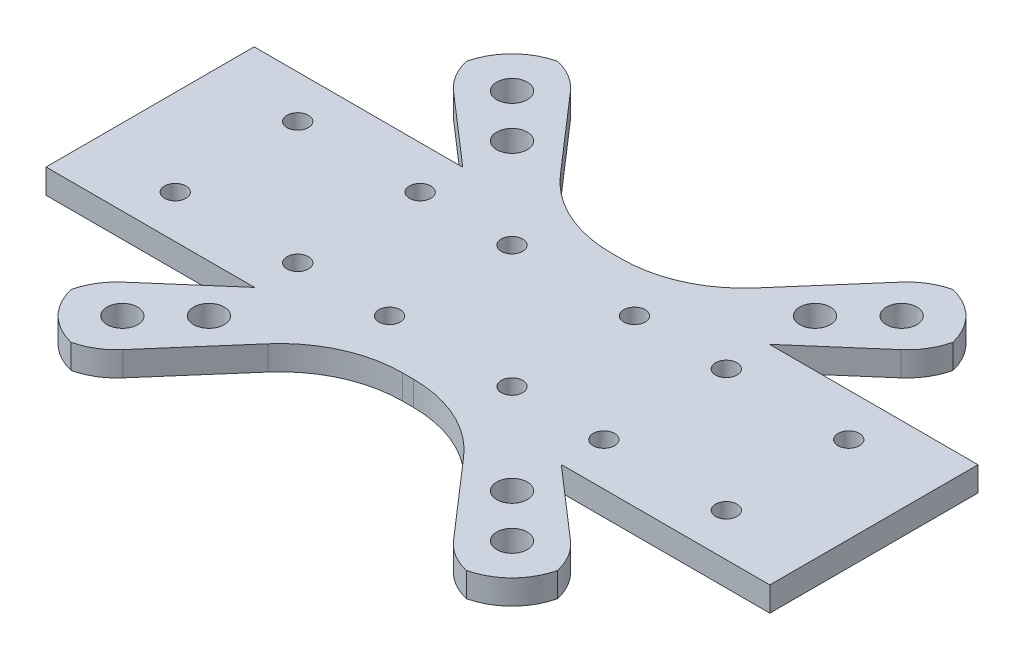
from build123d import *

# Parameters (mm, degrees)
SKETCH1_W           = 80
SKETCH1_H           = 80
SKETCH1_R           = 2.5
SKETCH1_R_2         = 1.75
BOSS_EXTRUDE1_DEPTH = 4
CUT_EXTRUDE2_DEPTH  = 57.709787515
FILLET1_R           = 10
FILLET2_R           = 20
BOSS_EXTRUDE3_DEPTH = 4
SKETCH6_R           = 1.75
CUT_EXTRUDE3_DEPTH  = 4


with BuildPart() as part:
    # Sketch1 → Boss-Extrude1 (new body)
    with BuildSketch(Plane(origin=(0, 0, 0), x_dir=(1, 0, 0), z_dir=(0, 1, 0))):
        Rectangle(SKETCH1_W, SKETCH1_H)
        with Locations(Location((-24.748737342, 24.748737342, 0), (0, 0, 270))):
            Circle(SKETCH1_R, mode=Mode.SUBTRACT)
        with Locations(Location((24.748737342, 24.748737342, 0), (0, 0, 270))):
            Circle(SKETCH1_R, mode=Mode.SUBTRACT)
        with Locations(Location((24.748737342, -24.748737342, 0), (0, 0, 270))):
            Circle(SKETCH1_R, mode=Mode.SUBTRACT)
        with Locations(Location((-24.748737342, -24.748737342, 0), (0, 0, 270))):
            Circle(SKETCH1_R, mode=Mode.SUBTRACT)
        with Locations(Location((-10, 10, 0), (0, 0, 270))):
            Circle(SKETCH1_R_2, mode=Mode.SUBTRACT)
        with Locations(Location((10, 10, 0), (0, 0, 270))):
            Circle(SKETCH1_R_2, mode=Mode.SUBTRACT)
        with Locations(Location((10, -10, 0), (0, 0, 270))):
            Circle(SKETCH1_R_2, mode=Mode.SUBTRACT)
        with Locations(Location((-10, -10, 0), (0, 0, 270))):
            Circle(SKETCH1_R_2, mode=Mode.SUBTRACT)
        with Locations(Location((31.819805153, 31.819805153, 0), (0, 0, 270))):
            Circle(SKETCH1_R, mode=Mode.SUBTRACT)
        with Locations(Location((-31.819805153, 31.819805153, 0), (0, 0, 270))):
            Circle(SKETCH1_R, mode=Mode.SUBTRACT)
        with Locations(Location((-31.819805153, -31.819805153, 0), (0, 0, 270))):
            Circle(SKETCH1_R, mode=Mode.SUBTRACT)
        with Locations(Location((31.819805153, -31.819805153, 0), (0, 0, 270))):
            Circle(SKETCH1_R, mode=Mode.SUBTRACT)
    extrude(amount=BOSS_EXTRUDE1_DEPTH)

    # Sketch2 → Cut-Extrude2 (cut, through all)
    with BuildSketch(Plane(origin=(0, 4, 0), x_dir=(1, 0, 0), z_dir=(0, 1, 0))):
        Polygon((-40, 30), (-40, -30), (-17, -10), (-17, 10), align=None)
        Polygon((30, 40), (-30, 40), (-10, 17), (10, 17), align=None)
        Polygon((40, -30), (40, 30), (17, 10), (17, -10), align=None)
        Polygon((-30, -40), (30, -40), (10, -17), (-10, -17), align=None)
    extrude(amount=-CUT_EXTRUDE2_DEPTH, mode=Mode.SUBTRACT)

    # Fillet1
    # the kernel refuses this fillet: 10 mm, written as the material it takes off along each edge
    with BuildSketch(Plane(origin=(-30, 15.390762292, 40), x_dir=(-1, 0, 0), z_dir=(0, -1, 0)), Plane(origin=(-40, 15.390762292, 30), x_dir=(0.754605522163505, 0, -0.6561787149247863), z_dir=(0, -1, 0)), Plane(origin=(-40, 15.390762292, -30), x_dir=(0, 0, -1), z_dir=(0, -1, 0)), Plane(origin=(-30, 15.390762292, -40), x_dir=(0.6561787149247871, 0, 0.7546055221635043), z_dir=(0, -1, 0)), Plane(origin=(30, 15.390762292, -40), x_dir=(1, 0, 0), z_dir=(0, -1, 0)), Plane(origin=(40, 15.390762292, -30), x_dir=(-0.7546055221635045, 0, 0.6561787149247867), z_dir=(0, -1, 0)), Plane(origin=(40, 15.390762292, 30), x_dir=(0, 0, 1), z_dir=(0, -1, 0))) as fillet1_piece_1:
        with BuildLine():
            CenterArc((FILLET1_R * 0.455630491663, FILLET1_R), FILLET1_R, 221.009086902, 48.990913098)
            Line((-FILLET1_R * 0.2989750305, FILLET1_R * 0.343821285075), (0, 0))
            Line((0, 0), (FILLET1_R * 0.455630491663, 0))
        make_face()
    extrude(amount=26.781524583, mode=Mode.SUBTRACT)
    with BuildSketch(Plane(origin=(-40, -25, 40), x_dir=(0, 0, -1), z_dir=(0, 1, 0)), Plane(origin=(-40, -25, -40), x_dir=(1, 0, 0), z_dir=(0, 1, 0)), Plane(origin=(40, -25, -40), x_dir=(0, 0, 1), z_dir=(0, 1, 0)), Plane(origin=(40, -25, 40), x_dir=(-1, 0, 0), z_dir=(0, 1, 0))) as fillet1_piece_2:
        with BuildLine():
            CenterArc((FILLET1_R, -FILLET1_R), FILLET1_R, 90, 90)
            Line((0, -FILLET1_R), (0, 0))
            Line((0, 0), (FILLET1_R, 0))
        make_face()
    extrude(amount=54, mode=Mode.SUBTRACT)
    with BuildSketch(Plane(origin=(30, 15.390762292, 40), x_dir=(1, 0, 0), z_dir=(0, -1, 0))) as fillet1_piece_3:
        with BuildLine():
            CenterArc((FILLET1_R * 0.455630491663, -FILLET1_R), FILLET1_R, 90, 48.990913098)
            Line((-FILLET1_R * 0.2989750305, -FILLET1_R * 0.343821285075), (0, 0))
            Line((0, 0), (FILLET1_R * 0.455630491663, 0))
        make_face()
    extrude(amount=26.781524583, mode=Mode.SUBTRACT)

    # Fillet2
    fillet2_edges = [part.edges().sort_by_distance(p)[0] for p in [
        (10, 2, 17),
        (-10, 2, 17),
        (-17, 2, 10),
        (-17, 2, -10),
        (17, 2, -10),
        (17, 2, 10),
        (-10, 2, -17),
        (10, 2, -17),
    ]]
    fillet(fillet2_edges, radius=FILLET2_R)

    # Sketch5 → Boss-Extrude3 (add)
    with BuildSketch(Plane(origin=(0, 4, 0), x_dir=(1, 0, 0), z_dir=(0, 1, 0))):
        Polygon((-0.887390167, 17), (13.289046487, 12.123524967), (13.289046487, -13.496190448), (-0.887390167, -17), (59.112609833, -17), (59.112609833, 17), align=None)
    boss_extrude3 = extrude(amount=-BOSS_EXTRUDE3_DEPTH)

    # Sketch6 → Cut-Extrude3 (cut)
    with BuildSketch(Plane(origin=(0, 4, 0), x_dir=(1, 0, 0), z_dir=(0, 1, 0))):
        with Locations(Location((25, 10, 0), (0, 0, 270))):
            Circle(SKETCH6_R)
        with Locations(Location((45, 10, 0), (0, 0, 270))):
            Circle(SKETCH6_R)
        with Locations(Location((25, -10, 0), (0, 0, 270))):
            Circle(SKETCH6_R)
        with Locations(Location((45, -10, 0), (0, 0, 270))):
            Circle(SKETCH6_R)
    cut_extrude3 = extrude(amount=-CUT_EXTRUDE3_DEPTH, mode=Mode.SUBTRACT)

    # Mirror1: Boss-Extrude3, Cut-Extrude3 across plane
    add(boss_extrude3.mirror(Plane(origin=(0, 0, 0), x_dir=(0, 0, 1), z_dir=(1, 0, 0))))
    add(cut_extrude3.mirror(Plane(origin=(0, 0, 0), x_dir=(0, 0, 1), z_dir=(1, 0, 0))), mode=Mode.SUBTRACT)


solid = part.part
